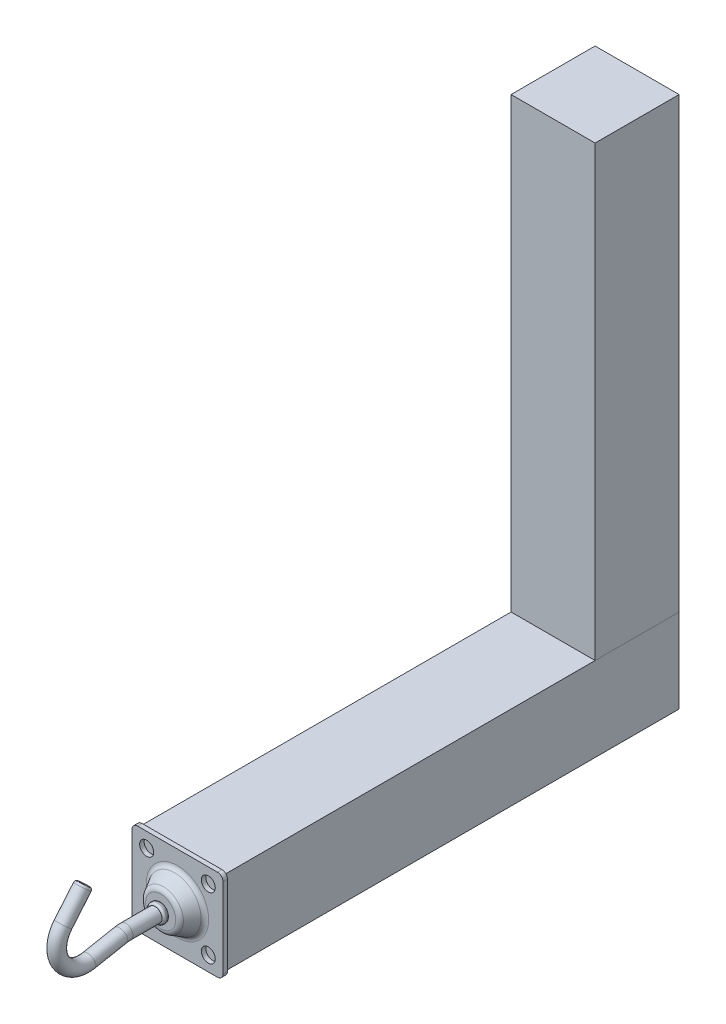
from build123d import *

# Parameters (mm, degrees)
SKETCH1_W           = 41.275
SKETCH1_H           = 41.275
BOSS_EXTRUDE1_DEPTH = 2.032
SKETCH2_R           = 12.7
BOSS_EXTRUDE2_DEPTH = 7.62
BOSS_EXTRUDE2_TAPER = 30
FILLET3_R           = 2.54
FILLET1_R           = 2.54
SKETCH3_R           = 4.1275
BOSS_EXTRUDE3_DEPTH = 2.54
FILLET4_R           = 1.016
SKETCH5_R           = 3.175
FILLET2_R           = 1.016
SKETCH6_R           = 3.175
CUT_EXTRUDE1_DEPTH  = 2.032
SKETCH7_W           = 38.1
SKETCH7_H           = 38.1
BOSS_EXTRUDE4_DEPTH = 206.375
SKETCH9_W           = 38.1
SKETCH9_H           = 38.1
BOSS_EXTRUDE5_DEPTH = 203.2


# Read off the part's stored shape, not the designer's step: Shell1
with BuildPart() as part:
    # Sketch1 → Boss-Extrude1 (new body)
    with BuildSketch(Plane.XY):
        Rectangle(SKETCH1_W, SKETCH1_H)
    extrude(amount=BOSS_EXTRUDE1_DEPTH)

    # Sketch2 → Boss-Extrude2 (add)
    with BuildSketch(Plane.XY.offset(2.032)):
        Circle(SKETCH2_R)
    extrude(amount=BOSS_EXTRUDE2_DEPTH, taper=BOSS_EXTRUDE2_TAPER)

    # Fillet3
    fillet3_edges = [part.edges().sort_by_distance(p)[0] for p in [
        (-12.7, 0, 2.032),
        (-8.300590949, 0, 9.652),
    ]]
    fillet(fillet3_edges, radius=FILLET3_R)

    # Shell1 outline → Shell1 (revolve, cut)
    with BuildSketch(Plane.XZ):
        with BuildLine():
            Line((10.207001538, 2.286), (7.27406217, 7.366))
            ThreePointArc((7.27406217, 7.366), (7.088121265, 7.551940905), (6.834121265, 7.62))
            Line((6.834121265, 7.62), (0, 7.62))
            Line((0, 7.62), (0, 0))
            Line((0, 0), (14.166469684, 0))
            ThreePointArc((14.166469684, 0), (11.880469684, 0.612531854), (10.207001538, 2.286))
        make_face()
    revolve(axis=Axis((0, 0, 0), (0, 0, 1)), mode=Mode.SUBTRACT)

    # Fillet1
    fillet1_edges = [part.edges().sort_by_distance(p)[0] for p in [
        (20.6375, -20.6375, 1.016),
        (-20.6375, -20.6375, 1.016),
        (-20.6375, 20.6375, 1.016),
        (20.6375, 20.6375, 1.016),
    ]]
    fillet(fillet1_edges, radius=FILLET1_R)


with BuildPart() as body_2:
    # Sketch3 → Boss-Extrude3 (new body)
    with BuildSketch(Plane.XY.offset(9.652)):
        Circle(SKETCH3_R)
    extrude(amount=BOSS_EXTRUDE3_DEPTH)

    # Fillet4
    fillet4_edges = [body_2.edges().sort_by_distance(p)[0] for p in [
        (-4.1275, 0, 9.652),
        (-4.1275, 0, 12.192),
    ]]
    fillet(fillet4_edges, radius=FILLET4_R)


with BuildPart() as part_1:
    add(part.part)

    # Combine1: union body 2
    add(body_2.part)

    # Sweep1: sweep along a path in Sketch4
    with BuildLine(Plane(origin=(0, 0, 0), x_dir=(0, 0, -1), z_dir=(1, 0, 0))) as sweep1_path:
        Line((-12.192, 0), (-25.4, 0))
        ThreePointArc((-25.4, 0), (-26.587891118, -0.055676582), (-27.765366848, -0.222218159))
        Line((-27.765366848, -0.222218159), (-42.208954144, -2.96023546))
        ThreePointArc((-42.208954144, -2.96023546), (-55.085066883, 2.89405056), (-53.897425307, 16.988604528))
        Line((-53.897425307, 16.988604528), (-44.494982099, 28.194))
    # Sketch5 → Sweep1 (sweep)
    with BuildSketch(Plane.XY.offset(12.192)):
        Circle(SKETCH5_R)
    sweep(path=sweep1_path.line)

    # Fillet2
    fillet2_edges = [part_1.edges().sort_by_distance(p)[0] for p in [
        (-3.175, 28.194, 44.494982099),
    ]]
    fillet(fillet2_edges, radius=FILLET2_R)

    # Sketch6 → Cut-Extrude1 (cut)
    with BuildSketch(Plane.XY.offset(2.032)):
        with Locations((-13.97, -13.97)):
            Circle(SKETCH6_R)
        with Locations((13.97, -13.97)):
            Circle(SKETCH6_R)
        with Locations((13.97, 13.97)):
            Circle(SKETCH6_R)
        with Locations((-13.97, 13.97)):
            Circle(SKETCH6_R)
    extrude(amount=-CUT_EXTRUDE1_DEPTH, mode=Mode.SUBTRACT)


with BuildPart() as body_2_2:
    # Sketch7 → Boss-Extrude4 (new body)
    with BuildSketch(Plane(origin=(0, 0, 0), x_dir=(-1, 0, 0), z_dir=(0, 0, -1))):
        Rectangle(SKETCH7_W, SKETCH7_H)
    extrude(amount=BOSS_EXTRUDE4_DEPTH)


with BuildPart() as body_3:
    # Sketch9 → Boss-Extrude5 (new body)
    with BuildSketch(Plane(origin=(0, 19.05, 0), x_dir=(1, 0, 0), z_dir=(0, 1, 0))):
        with Locations((0, 187.325)):
            Rectangle(SKETCH9_W, SKETCH9_H)
    extrude(amount=BOSS_EXTRUDE5_DEPTH)


solid = Compound([part_1.part, body_2_2.part, body_3.part])
